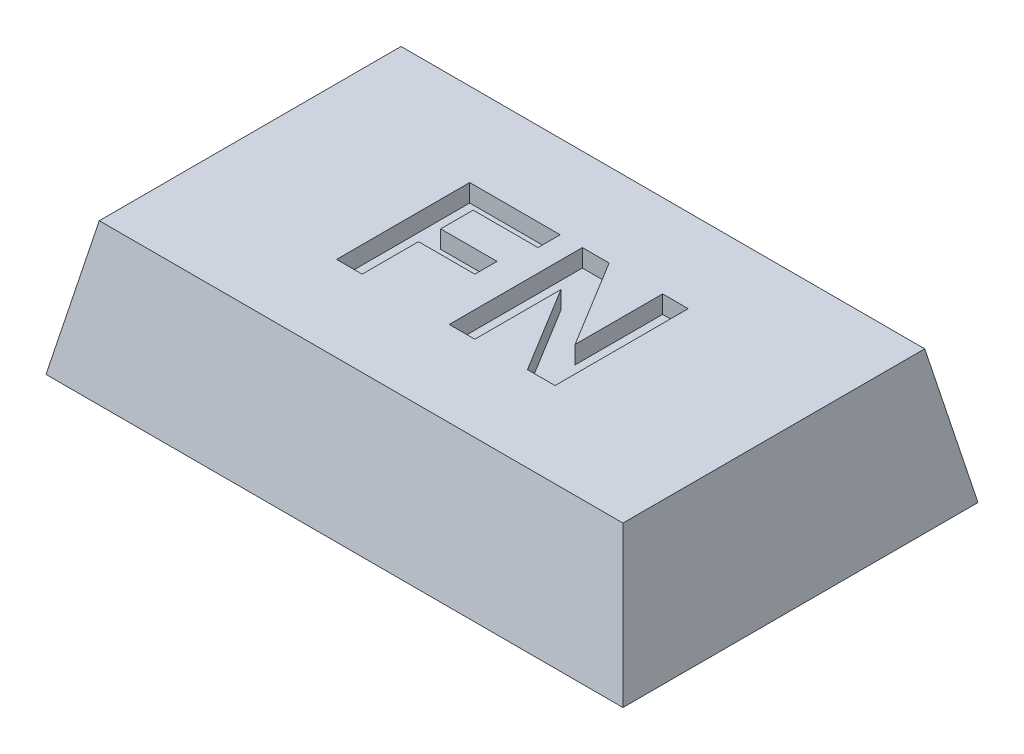
from build123d import *

# Parameters (mm, degrees)
SKETCH1_W               = 13
SKETCH1_H               = 8
BOSS_EXTRUDE1_DEPTH     = 3
CUT_EXTRUDE1_DEPTH      = 16.556349186
CUT_EXTRUDE1_DEPTH_BACK = 16.556349186
CUT_EXTRUDE2_DEPTH      = 16.556349186
CUT_EXTRUDE2_DEPTH_BACK = 16.556349186
SKETCH4_R               = 1.8
CUT_EXTRUDE3_DEPTH      = 0.8
SKETCH5_W               = 8
SKETCH5_H               = 1
BOSS_EXTRUDE2_DEPTH     = 2
FILLET1_R               = 4
CUT_EXTRUDE4_DEPTH      = 0.4


with BuildPart() as part:
    # Sketch1 → Boss-Extrude1 (new body)
    with BuildSketch(Plane(origin=(0, 0, 0), x_dir=(1, 0, 0), z_dir=(0, 1, 0))):
        with Locations((6.5, 4)):
            Rectangle(SKETCH1_W, SKETCH1_H)
    extrude(amount=BOSS_EXTRUDE1_DEPTH)

    # Sketch2 → Cut-Extrude1 (cut, two sides: drawn at the far end of the back side and taken through both)
    with BuildSketch(Plane.XY.offset(-CUT_EXTRUDE1_DEPTH_BACK)):
        Polygon((0, 0), (0.6, 3), (0, 3), align=None)
        Polygon((13, 0), (12.4, 3), (13, 3), align=None)
    extrude(amount=CUT_EXTRUDE1_DEPTH + CUT_EXTRUDE1_DEPTH_BACK, mode=Mode.SUBTRACT)

    # Sketch3 → Cut-Extrude2 (cut, two sides: drawn at the far end of the back side and taken through both)
    with BuildSketch(Plane(origin=(0, 0, 0), x_dir=(0, 0, -1), z_dir=(1, 0, 0)).offset(-CUT_EXTRUDE2_DEPTH_BACK)):
        Polygon((0, 0), (0.6, 3), (0, 3), align=None)
        Polygon((8, 3), (7.4, 3), (8, 0), align=None)
    extrude(amount=CUT_EXTRUDE2_DEPTH + CUT_EXTRUDE2_DEPTH_BACK, mode=Mode.SUBTRACT)

    # Sketch4 → Cut-Extrude3 (cut)
    with BuildSketch(Plane.XZ):
        with Locations(Location((6.50000125, -3.75, 0), (0, 0, 270))):
            Circle(SKETCH4_R)
    extrude(amount=-CUT_EXTRUDE3_DEPTH, mode=Mode.SUBTRACT)

    # Sketch5 → Boss-Extrude2 (add)
    with BuildSketch(Plane.XZ):
        with Locations((6.500011, -7.5)):
            Rectangle(SKETCH5_W, SKETCH5_H)
    extrude(amount=BOSS_EXTRUDE2_DEPTH)

    # Fillet1
    # the kernel refuses this fillet: 4 mm, written as the material it takes off along each edge
    with BuildSketch(Plane(origin=(10.500011, -2, -16.660254038), x_dir=(0, 1, 0), z_dir=(0, 0, 1)), Plane(origin=(2.500011, -2, 1.660254038), x_dir=(0, 1, 0), z_dir=(0, 0, -1))) as fillet1_piece_1:
        with BuildLine():
            CenterArc((4, 3.464101615), FILLET1_R, 180, 60)
            Line((0, 3.464101615), (-0.08, 3.464101615))
            Line((-0.08, 3.464101615), (-0.08, 0))
            Line((-0.08, 0), (0, -0.08))
            ThreePointArc((0, -0.08), (1, -0.08), (1.96, -0.069282032))
            Line((1.96, -0.069282032), (2, 0))
        make_face()
    extrude(amount=18.320508076, mode=Mode.SUBTRACT)

    # Sketch6 → Cut-Extrude4 (cut)
    with BuildSketch(Plane(origin=(0, 3, 0), x_dir=(1, 0, 0), z_dir=(0, 1, 0))):
        Polygon((4.028737707, 2.518536397), (4.028737707, 5.518536397), (6.067199245, 5.518536397), (6.067199245, 5.018536397), (4.605660784, 5.018536397), (4.605660784, 4.287767167), (5.874891553, 4.287767167), (5.874891553, 3.787767167), (4.605660784, 3.787767167), (4.605660784, 2.518536397), align=None)
        Polygon((6.567199245, 2.518536397), (6.567199245, 5.518536397), (7.169963668, 5.518536397), (8.374891553, 3.546180628), (8.374891553, 5.518536397), (8.95181463, 5.518536397), (8.95181463, 2.518536397), (8.330420399, 2.518536397), (7.144122322, 4.459642167), (7.144122322, 2.518536397), align=None)
    extrude(amount=-CUT_EXTRUDE4_DEPTH, mode=Mode.SUBTRACT)


solid = part.part
